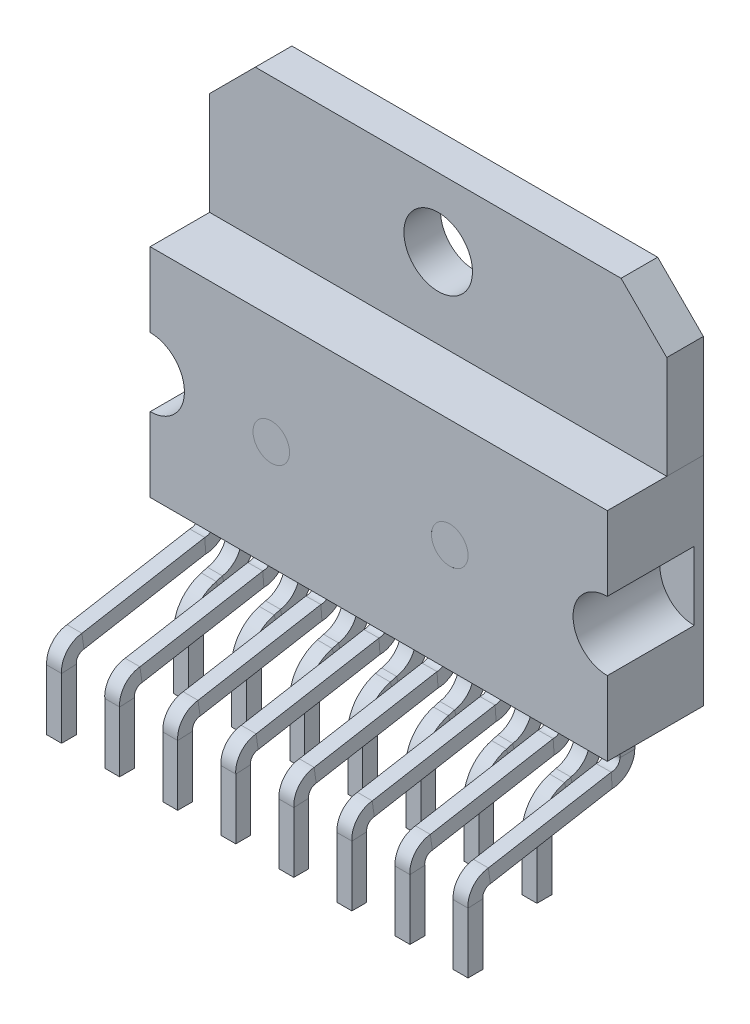
from build123d import *

# Parameters (mm, degrees)
SKETCH2_R           = 1.5
SKETCH2_W           = 20
SKETCH2_H           = 9.5
BOSS_EXTRUDE1_DEPTH = 1.6
SKETCH3_W           = 20
SKETCH3_H           = 9.5
BOSS_EXTRUDE3_DEPTH = 2.6
SKETCH6_W           = 0.65
SKETCH6_H           = 0.65
LPATTERN1_COUNT     = 8
LPATTERN1_PITCH     = 2.54
SWEEP3_START        = -7.633539823
SWEEP3_DEPTH        = 0.65
LPATTERN3_COUNT     = 7
LPATTERN3_PITCH     = 2.54
CUT_EXTRUDE1_DEPTH  = 3.8
SKETCH11_R          = 0.8
CUT_EXTRUDE2_DEPTH  = 0.0001
SKETCH16_W          = 1.6
SKETCH16_H          = 4.5
BOSS_EXTRUDE6_DEPTH = 0.0001
SKETCH17_W          = 1.6
SKETCH17_H          = 4.5
BOSS_EXTRUDE7_DEPTH = 0.0001
SKETCH18_W          = 0.65
SKETCH18_H          = 0.65
BOSS_EXTRUDE9_DEPTH = 1.3


# Read off the part's stored shape, not the designer's step: Sweep3
with BuildPart() as part:
    # Sketch2 → Boss-Extrude1 (new body)
    # profile 1 of 2: a face of its own
    with BuildSketch(Plane.XY):
        Polygon((-7.203539823, 6.502223764), (-9.203539823, 4.5), (-9.203539823, 0), (10.796460177, 0), (10.796460177, 4.5), (8.796460177, 6.502223764), align=None)
        with Locations((0.796460177, 3.502223764)):
            Circle(SKETCH2_R, mode=Mode.SUBTRACT)
    # profile 2 of 2: a face of its own
    with BuildSketch(Plane.XY):
        with Locations((0.796460177, -4.75)):
            Rectangle(SKETCH2_W, SKETCH2_H)
    extrude(amount=BOSS_EXTRUDE1_DEPTH)

    # Sketch3 → Boss-Extrude3 (add)
    with BuildSketch(Plane.XY.offset(1.6)):
        with Locations((0.796460177, -4.75)):
            Rectangle(SKETCH3_W, SKETCH3_H)
    extrude(amount=BOSS_EXTRUDE3_DEPTH)

    # Sweep1: sweep along a path in Sketch5
    with BuildLine(Plane.ZY.offset(8.533539823)) as sweep1_path:
        Line((2.1, -9.5), (2.1, -10.86))
        ThreePointArc((2.1, -10.86), (2.301441163, -11.343095684), (2.786415999, -11.539969731))
        Line((2.786415999, -11.539969731), (8.134434324, -12.479969731))
        ThreePointArc((8.134434324, -12.479969731), (8.593539608, -12.72510232), (8.744841152, -13.223073696))
        Line((8.744841152, -13.223073696), (8.744841152, -14.583073696))
    # Sketch6 → Sweep1 (sweep)
    with BuildSketch(Plane(origin=(0, -14.583073696, 0), x_dir=(1, 0, 0), z_dir=(0, 1, 0))):
        with Locations((-8.533539823, -8.744841152)):
            Rectangle(SKETCH6_W, SKETCH6_H)
    sweep1 = sweep(path=sweep1_path.line, transition=Transition.RIGHT)

    # LPattern1: Sweep1 ×8
    with Locations(*[(i * LPATTERN1_PITCH, 0, 0) for i in range(1, LPATTERN1_COUNT)]):
        add(sweep1)

    # Sweep3 outline → Sweep3 (add)
    with BuildSketch(Plane.YZ.offset(SWEEP3_START)):
        with BuildLine():
            add(Edge.make_bspline(
                [(-12.532932799, 3.359604494), (-12.594860042, 3.582481456), (-12.735290458, 3.781390115), (-13.020819333, 3.980886858), (-13.127672403, 4.030760368), (-13.352249722, 4.091227183), (-13.450646146, 4.103742549), (-13.593012032, 4.091367167), (-13.597716817, 4.090958057), (-13.602538148, 4.090538694)],
                knots=[0.127705256, 0.127705256, 0.127705256, 0.127705256, 0.563852628, 0.563852628, 0.781926314, 0.781926314, 1, 1, 1.007228713, 1.007228713, 1.007228713, 1.007228713], degree=3))
            Line((-12.532932799, 3.359604494), (-12.464225257, 3.112325143))
            ThreePointArc((-12.464225257, 3.112325143), (-11.891967944, 2.152350422), (-10.84, 1.775))
            Line((-10.84, 1.775), (-9.5, 1.775))
            Line((-9.5, 1.775), (-9.5, 2.425))
            Line((-9.5, 2.425), (-10.84, 2.425))
            add(Edge.make_bspline(
                [(-10.84, 2.425), (-11.071320392, 2.425), (-11.300563589, 2.50705433), (-11.569218001, 2.72875344), (-11.645876926, 2.818354528), (-11.764258681, 3.018546854), (-11.802659127, 3.110001196), (-11.828848513, 3.25048362), (-11.829713864, 3.2551262), (-11.830600536, 3.259883815)],
                knots=[0.420822097, 0.420822097, 0.420822097, 0.420822097, 0.710411048, 0.710411048, 0.855205524, 0.855205524, 1, 1, 1.004799651, 1.004799651, 1.004799651, 1.004799651], degree=3))
            Line((-11.830600536, 3.259883815), (-11.906658461, 3.533617288))
            ThreePointArc((-11.906658461, 3.533617288), (-12.551859641, 4.446166099), (-13.629994453, 4.740538694))
            Line((-13.629994453, 4.740538694), (-15.876641689, 4.740538694))
            Line((-15.876641689, 4.740538694), (-15.876641689, 4.090538694))
            Line((-15.876641689, 4.090538694), (-13.602538148, 4.090538694))
        make_face()
    sweep3 = extrude(amount=SWEEP3_DEPTH)

    # LPattern3: Sweep3 ×7
    with Locations(*[(i * LPATTERN3_PITCH, 0, 0) for i in range(1, LPATTERN3_COUNT)]):
        add(sweep3)

    # Sketch10 → Cut-Extrude1 (cut)
    with BuildSketch(Plane.XY.offset(4.2)):
        with BuildLine():
            Line((-9.203539823, -3.25), (-9.203539823, -6.25))
            ThreePointArc((-9.203539823, -6.25), (-7.703539823, -4.75), (-9.203539823, -3.25))
        make_face()
        with BuildLine():
            Line((10.796460177, -3.25), (10.796460177, -6.25))
            ThreePointArc((10.796460177, -6.25), (9.296460177, -4.75), (10.796460177, -3.25))
        make_face()
    extrude(amount=-CUT_EXTRUDE1_DEPTH, mode=Mode.SUBTRACT)

    # Sketch11 → Cut-Extrude2 (cut)
    with BuildSketch(Plane.XY.offset(4.2)):
        with Locations((-3.903539823, -4.75)):
            Circle(SKETCH11_R)
        with Locations(Location((3.903539823, -4.75, 0), (0, 0, 180))):
            Circle(SKETCH11_R)
    extrude(amount=-CUT_EXTRUDE2_DEPTH, mode=Mode.SUBTRACT)

    # Sketch16 → Boss-Extrude6 (add)
    with BuildSketch(Plane(origin=(10.796460177, 0, 0), x_dir=(0, 0, -1), z_dir=(1, 0, 0))):
        with Locations((-0.8, 2.25)):
            Rectangle(SKETCH16_W, SKETCH16_H)
    extrude(amount=BOSS_EXTRUDE6_DEPTH)

    # Sketch17 → Boss-Extrude7 (add)
    with BuildSketch(Plane.ZY.offset(9.203539823)):
        with Locations((0.8, 2.25)):
            Rectangle(SKETCH17_W, SKETCH17_H)
    extrude(amount=BOSS_EXTRUDE7_DEPTH)

    # Sketch18 → Boss-Extrude9 (add)
    with BuildSketch(Plane(origin=(0, -14.583073696, 0), x_dir=(-1, 0, 0), z_dir=(0, -1, 0))):
        with Locations((5.993539823, -8.744841152)):
            Rectangle(SKETCH18_W, SKETCH18_H)
        with Locations((8.533539823, -8.744841152)):
            Rectangle(SKETCH18_W, SKETCH18_H)
        with Locations((3.453539823, -8.744841152)):
            Rectangle(SKETCH18_W, SKETCH18_H)
        with Locations((0.913539823, -8.744841152)):
            Rectangle(SKETCH18_W, SKETCH18_H)
        with Locations((-1.626460177, -8.744841152)):
            Rectangle(SKETCH18_W, SKETCH18_H)
        with Locations((-4.166460177, -8.744841152)):
            Rectangle(SKETCH18_W, SKETCH18_H)
        with Locations((-6.706460177, -8.744841152)):
            Rectangle(SKETCH18_W, SKETCH18_H)
        with Locations((-9.246460177, -8.744841152)):
            Rectangle(SKETCH18_W, SKETCH18_H)
    extrude(amount=BOSS_EXTRUDE9_DEPTH)


solid = part.part
